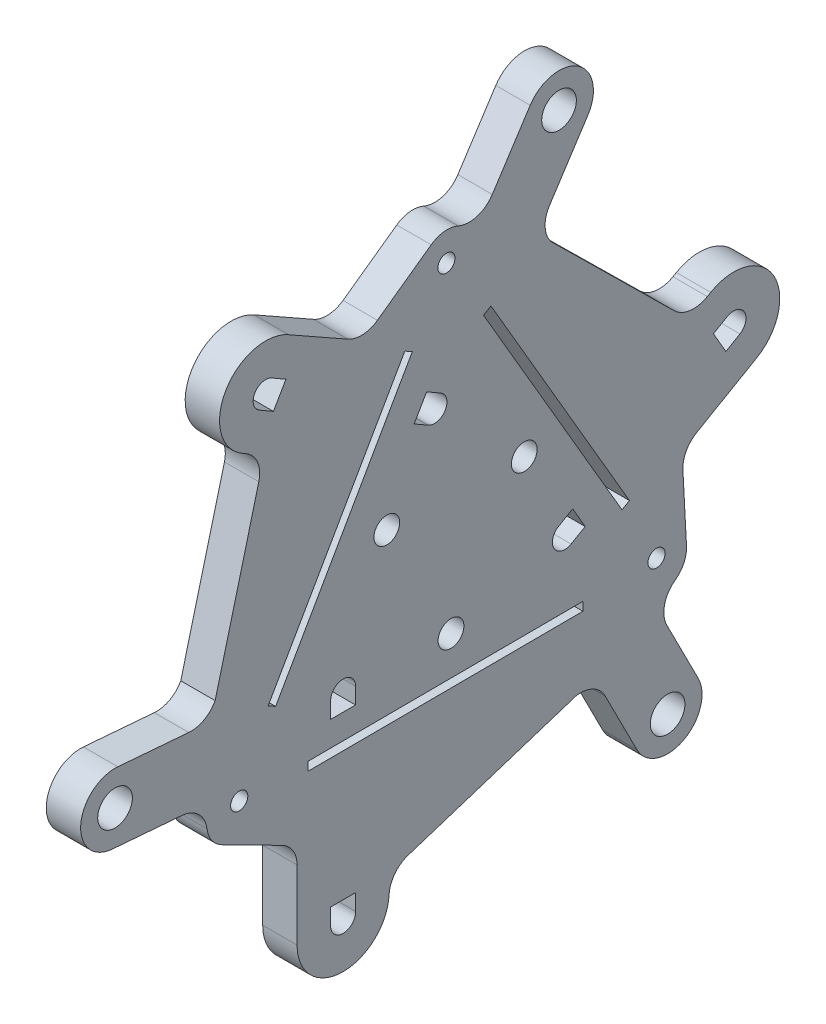
from build123d import *

# Parameters (mm, degrees)
BOSS_EXTRUDE1_DEPTH = 3.175
SKETCH7_R           = 0.79375
CUT_EXTRUDE6_DEPTH  = 59.953525128
SKETCH8_W           = 24
SKETCH8_H           = 4.7625
BOSS_EXTRUDE2_DEPTH = 3.175
BOSS_EXTRUDE3_DEPTH = 3.175
CUT_EXTRUDE8_DEPTH  = 3.175
CUT_EXTRUDE7_DEPTH  = 3.175
FILLET1_R           = 2.54
FILLET2_R           = 2.54
SKETCH13_R          = 1.190625
CUT_EXTRUDE9_DEPTH  = 3.175
CUT_EXTRUDE10_DEPTH = 3.175
SKETCH17_R          = 1.6
BOSS_EXTRUDE5_DEPTH = 3.175
FILLET4_R           = 2.54


with BuildPart() as part:
    # Sketch1 → Boss-Extrude1 (new body)
    with BuildSketch(Plane(origin=(0, 0, 0), x_dir=(0, 0, -1), z_dir=(1, 0, 0))):
        Polygon((43.890597967, 11.483842091), (31.890597967, 32.268451781), (22.25, 38.538130468), (44.5, 0), align=None)
        Polygon((22.25, 38.538130468), (44.5, 0), (0, 0), align=None)
        Polygon((0.899789316, 11.058480811), (12.899789316, 31.843090502), (22.25, 38.538130468), (0, 0), align=None)
        Polygon((10.25, -5.214163404), (34.25, -5.214163404), (44.5, 0), (0, 0), align=None)
    extrude(amount=BOSS_EXTRUDE1_DEPTH)

    # Sketch7 → Cut-Extrude6 (cut, through all)
    with BuildSketch(Plane.ZY):
        with Locations((-22.25, 35.363130468)):
            Circle(SKETCH7_R)
        with Locations((-3.119892109, 1.92699728)):
            Circle(SKETCH7_R)
        with Locations((-41.6414868, 2.077904463)):
            Circle(SKETCH7_R)
    extrude(amount=-CUT_EXTRUDE6_DEPTH, mode=Mode.SUBTRACT)

    # Sketch8 → Boss-Extrude2 (add)
    with BuildSketch(Plane.ZY):
        Polygon((-43.890597967, 11.483842091), (-31.890597967, 32.268451781), (-36.015043953, 34.649701781), (-48.015043953, 13.865092091), align=None)
        with Locations((-22.25, -7.595413404)):
            Rectangle(SKETCH8_W, SKETCH8_H)
        Polygon((-12.899789316, 31.843090502), (-0.899789316, 11.058480811), (3.22465667, 13.439730811), (-8.77534333, 34.224340502), align=None)
    extrude(amount=-BOSS_EXTRUDE2_DEPTH)

    # Sketch9 → Boss-Extrude3 (add)
    # profile 1 of 3: a face of its own
    with BuildSketch(Plane(origin=(3.175, 0, 0), x_dir=(0, 0, -1), z_dir=(1, 0, 0))):
        with BuildLine():
            Line((3.432653779, 29.558030749), (5.419099548, 28.411155749))
            Line((5.419099548, 28.411155749), (8.77534333, 34.224340502))
            Line((8.77534333, 34.224340502), (12.899789316, 31.843090502))
            Line((12.899789316, 31.843090502), (14.562601584, 33.033715502))
            Line((14.562601584, 33.033715502), (7.682653779, 36.919246681))
            ThreePointArc((7.682653779, 36.919246681), (1.877045812, 35.363638715), (3.432653779, 29.558030749))
        make_face()
        with BuildLine():
            Line((4.98264756, 32.24269873), (6.281769095, 31.492650563))
            Line((6.281769095, 31.492650563), (7.43173356, 33.484529507))
            Line((7.43173356, 33.484529507), (6.13264756, 34.234557159))
            ThreePointArc((6.13264756, 34.234557159), (4.561718346, 33.813627945), (4.98264756, 32.24269873))
        make_face(mode=Mode.SUBTRACT)
    # profile 2 of 3: a face of its own
    with BuildSketch(Plane(origin=(3.175, 0, 0), x_dir=(0, 0, -1), z_dir=(1, 0, 0))):
        with BuildLine():
            Line((8.462487563, -12.270413404), (8.462487563, -4.304857849))
            Line((8.462487563, -4.304857849), (10.25, -5.214163404))
            Line((10.25, -5.214163404), (10.25, -9.976663404))
            Line((10.25, -9.976663404), (20.606380555, -9.976663404))
            Line((20.606380555, -9.976663404), (20.606380555, -10.770413404))
            Line((20.606380555, -10.770413404), (16.962487563, -10.770413404))
            Line((16.962487563, -10.770413404), (16.962487563, -12.270413404))
            ThreePointArc((16.962487563, -12.270413404), (12.712487563, -16.520413404), (8.462487563, -12.270413404))
        make_face()
        with BuildLine():
            Line((11.5625, -12.270413404), (11.5625, -10.7703581))
            Line((11.5625, -10.7703581), (13.8625, -10.770317068))
            Line((13.8625, -10.770317068), (13.8625, -12.270413404))
            ThreePointArc((13.8625, -12.270413404), (12.7125, -13.457465158), (11.5625, -12.270413404))
        make_face(mode=Mode.SUBTRACT)
    # profile 3 of 3: a face of its own
    with BuildSketch(Plane(origin=(3.175, 0, 0), x_dir=(0, 0, -1), z_dir=(1, 0, 0))):
        with BuildLine():
            Line((46.645245941, 20.825151843), (44.658800171, 19.678276843))
            Line((44.658800171, 19.678276843), (48.015043953, 13.865092091))
            Line((48.015043953, 13.865092091), (43.890597967, 11.483842091))
            Line((43.890597967, 11.483842091), (43.996871736, 9.481172067))
            Line((43.996871736, 9.481172067), (50.895245941, 13.463935911))
            ThreePointArc((50.895245941, 13.463935911), (52.450853907, 19.269543877), (46.645245941, 20.825151843))
        make_face()
        with BuildLine():
            Line((48.195239723, 18.140483862), (46.896118188, 17.390435694))
            Line((46.896118188, 17.390435694), (48.046153723, 15.398212801))
            Line((48.046153723, 15.398212801), (49.345239723, 16.148625433))
            ThreePointArc((49.345239723, 16.148625433), (49.750491106, 17.710503048), (48.195239723, 18.140483862))
        make_face(mode=Mode.SUBTRACT)
    extrude(amount=-BOSS_EXTRUDE3_DEPTH)

    # Sketch12 → Cut-Extrude8 (cut)
    with BuildSketch(Plane(origin=(3.175, 0, 0), x_dir=(0, 0, -1), z_dir=(1, 0, 0))):
        with BuildLine():
            Line((33.756782454, 7.148625433), (35.055868454, 7.898653085))
            Line((35.055868454, 7.898653085), (33.905903989, 9.89053203))
            Line((33.905903989, 9.89053203), (32.606782454, 9.140483862))
            ThreePointArc((32.606782454, 9.140483862), (32.18585324, 7.569554647), (33.756782454, 7.148625433))
        make_face()
        with BuildLine():
            Line((21.721104828, 25.234557159), (20.422018828, 25.984584811))
            Line((20.422018828, 25.984584811), (19.271959255, 23.992760775))
            Line((19.271959255, 23.992760775), (20.571104828, 23.24269873))
            ThreePointArc((20.571104828, 23.24269873), (22.142034043, 23.663627945), (21.721104828, 25.234557159))
        make_face()
        with BuildLine():
            Line((13.8625, 5.729586596), (13.8625, 4.229490261))
            Line((13.8625, 4.229490261), (11.5625, 4.229531293))
            Line((11.5625, 4.229531293), (11.5625, 5.729586596))
            ThreePointArc((11.5625, 5.729586596), (12.7125, 6.879586596), (13.8625, 5.729586596))
        make_face()
    extrude(amount=-CUT_EXTRUDE8_DEPTH, mode=Mode.SUBTRACT)

    # Sketch10 → Cut-Extrude7 (cut)
    with BuildSketch(Plane(origin=(3.175, 0, 0), x_dir=(0, 0, -1), z_dir=(1, 0, 0))):
        Polygon((31.890597967, 32.268451781), (44.658800171, 19.678276843), (36.015043953, 34.649701781), align=None)
        Polygon((5.419099548, 28.411155749), (0.899789316, 11.058480811), (-3.22465667, 13.439730811), align=None)
        Polygon((16.962487563, -10.770413404), (34.25, -5.214163404), (34.25, -11.414104667), align=None)
    extrude(amount=-CUT_EXTRUDE7_DEPTH, mode=Mode.SUBTRACT)

    # Fillet1
    fillet1_edges = [part.edges().sort_by_distance(p)[0] for p in [
        (1.5875, -10.770413404, -16.962487563),
    ]]
    fillet(fillet1_edges, radius=FILLET1_R)

    # Fillet2
    fillet2_edges = [part.edges().sort_by_distance(p)[0] for p in [
        (1.5875, 19.678276843, -44.658800171),
        (1.5875, 9.481172067, -43.996871736),
        (1.5875, -4.304857849, -8.462487563),
        (1.5875, 0, -44.5),
        (1.5875, 0, 0),
        (1.5875, 38.538130468, -22.25),
        (1.5875, 33.033715502, -14.562601584),
        (1.5875, 28.411155749, -5.419099548),
    ]]
    fillet(fillet2_edges, radius=FILLET2_R)

    # Sketch13 → Cut-Extrude9 (cut)
    with BuildSketch(Plane.ZY):
        with BuildLine():
            ThreePointArc((-15.555361616, 16.777538207), (-16.768661404, 17.967947273), (-17.935747959, 16.732196856))
            Line((-17.935747959, 16.732196856), (-16.745986616, 16.777538207))
            Line((-16.745986616, 16.777538207), (-17.301600526, 15.724503984))
            ThreePointArc((-17.301600526, 15.724503984), (-16.131145141, 15.757951109), (-15.555361616, 16.777538207))
        make_face()
        with BuildLine():
            Line((-16.745986616, 16.777538207), (-17.935747959, 16.732196856))
            ThreePointArc((-17.935747959, 16.732196856), (-17.753679488, 16.143390774), (-17.301600526, 15.724503984))
            Line((-17.301600526, 15.724503984), (-16.745986616, 16.777538207))
        make_face()
        with Locations((-22.672534986, 5.545173165)):
            Circle(SKETCH13_R)
        with Locations((-29.436774271, 16.293897131)):
            Circle(SKETCH13_R)
    extrude(amount=-CUT_EXTRUDE9_DEPTH, mode=Mode.SUBTRACT)

    # Sketch14 → Cut-Extrude10 (cut)
    with BuildSketch(Plane.ZY):
        Polygon((-6.482836936, 7.804845527), (-19.096567387, 29.85147348), (-18.407610264, 30.245652557), (-5.793879812, 8.199024604), align=None)
        Polygon((-34.848617406, 2.021173684), (-9.448812305, 1.921670715), (-9.451921773, 1.127926805), (-34.851726873, 1.227429774), align=None)
        Polygon((-25.674533914, 29.478496091), (-38.460608564, 7.531371107), (-39.146456219, 7.930935939), (-26.36038157, 29.878060923), align=None)
    extrude(amount=-CUT_EXTRUDE10_DEPTH, mode=Mode.SUBTRACT)

    # Sketch17 → Boss-Extrude5 (add)
    # profile 1 of 3: a face of its own
    with BuildSketch(Plane.ZY):
        with BuildLine():
            Line((-35.808950658, -4.421126968), (-39.839725672, -12.34482262))
            ThreePointArc((-39.839725672, -12.34482262), (-44.109179481, -13.735151419), (-45.499508281, -9.46569761))
            Line((-45.499508281, -9.46569761), (-41.468733267, -1.542001958))
            Line((-41.468733267, -1.542001958), (-35.808950658, -4.421126968))
        make_face()
        with Locations((-42.669616976, -10.905260115)):
            Circle(SKETCH17_R, mode=Mode.SUBTRACT)
    # profile 2 of 3: a face of its own
    with BuildSketch(Plane.ZY):
        with BuildLine():
            Line((-0.261472593, 3.213518539), (8.599244609, 3.934483634))
            ThreePointArc((8.599244609, 3.934483634), (11.506298933, 7.356513026), (8.084269542, 10.26356735))
            Line((8.084269542, 10.26356735), (-0.77644766, 9.542602255))
            Line((-0.77644766, 9.542602255), (-0.261472593, 3.213518539))
        make_face()
        with Locations((8.341757075, 7.099025492)):
            Circle(SKETCH17_R, mode=Mode.SUBTRACT)
    # profile 3 of 3: a face of its own
    with BuildSketch(Plane.ZY):
        with BuildLine():
            Line((-25.13548002, 36.661583739), (-29.98221424, 44.114185124))
            ThreePointArc((-29.98221424, 44.114185124), (-34.374834099, 45.044851969), (-35.305500944, 40.65223211))
            Line((-35.305500944, 40.65223211), (-30.458766724, 33.199630725))
            Line((-30.458766724, 33.199630725), (-25.13548002, 36.661583739))
        make_face()
        with Locations((-32.643857592, 42.383208617)):
            Circle(SKETCH17_R, mode=Mode.SUBTRACT)
    extrude(amount=-BOSS_EXTRUDE5_DEPTH)

    # Fillet4
    # the kernel refuses this fillet: 2.54 mm, written as the material it adds along each edge
    with BuildSketch(Plane(origin=(0, 36.661583739, -25.13548002), x_dir=(0, 0.5315830218036889, 0.8470061929703104), z_dir=(1, 0, 0))) as fillet4_piece_1:
        with BuildLine():
            CenterArc((2.499765737, -2.512091747), FILLET4_R, 98.501304121, 80.573560632)
            Line((-0.039903163, -2.471081023), (-0.293870053, -2.46697995))
            Line((-0.293870053, -2.46697995), (-0.25396689, 0.004101072))
            Line((-0.25396689, 0.004101072), (0.004101072, 0.25396689))
            ThreePointArc((0.004101072, 0.25396689), (1.711869919, 0.226389737), (2.086723346, 0.251209175))
            Line((2.086723346, 0.251209175), (2.124272654, 0))
        make_face()
    extrude(amount=3.175)
    with BuildSketch(Plane(origin=(0, 33.199630725, -30.458766724), x_dir=(0, -0.5451894510403108, -0.838312866699757), z_dir=(1, 0, 0))) as fillet4_piece_2:
        with BuildLine():
            CenterArc((2.54, 2.399867047), FILLET4_R, 180, 70.879109992)
            Line((0, 2.399867047), (-0.0508, 2.399867047))
            Line((-0.0508, 2.399867047), (-0.0508, 0))
            Line((-0.0508, 0), (0, -0.0508))
            ThreePointArc((0, -0.0508), (0.853995746, -0.0508), (1.691351321, -0.047997341))
            Line((1.691351321, -0.047997341), (1.707991491, 0))
        make_face()
    extrude(amount=3.175)
    with BuildSketch(Plane(origin=(0, -1.542001958, -41.468733267), x_dir=(0, 0.466230647669412, -0.8846632032439015), z_dir=(1, 0, 0))) as fillet4_piece_3:
        with BuildLine():
            CenterArc((2.503946527, -2.514474671), FILLET4_R, 98.12963068, 81.042861753)
            Line((-0.035788565, -2.477791408), (-0.289762074, -2.474123082))
            Line((-0.289762074, -2.474123082), (-0.253973509, 0.003668326))
            Line((-0.253973509, 0.003668326), (0.003668326, 0.253973509))
            ThreePointArc((0.003668326, 0.253973509), (1.752552501, 0.228713088), (2.108838028, 0.251447467))
            Line((2.108838028, 0.251447467), (2.144756982, 0))
        make_face()
    extrude(amount=3.175)
    with BuildSketch(Plane(origin=(0, -4.421126968, -35.808950658), x_dir=(0, -0.4534055133611399, 0.8913043478261066), z_dir=(1, 0, 0))) as fillet4_piece_4:
        with BuildLine():
            CenterArc((2.54, 2.413715879), FILLET4_R, 180, 71.856915027)
            Line((0, 2.413715879), (-0.0508, 2.413715879))
            Line((-0.0508, 2.413715879), (-0.0508, 0))
            Line((-0.0508, 0), (0, -0.0508))
            ThreePointArc((0, -0.0508), (0.874533296, -0.0508), (1.733247924, -0.048274318))
            Line((1.733247924, -0.048274318), (1.749066592, 0))
        make_face()
    extrude(amount=3.175)
    with BuildSketch(Plane(origin=(0, 9.542602255, -0.77644766), x_dir=(0, 0.9967060969511591, -0.08109843586892752), z_dir=(1, 0, 0))) as fillet4_piece_5:
        with BuildLine():
            CenterArc((2.54, 2.326587881), FILLET4_R, 180, 66.345211462)
            Line((0, 2.326587881), (-0.0508, 2.326587881))
            Line((-0.0508, 2.326587881), (-0.0508, 0))
            Line((-0.0508, 0), (0, -0.0508))
            ThreePointArc((0, -0.0508), (0.760444107, -0.0508), (1.500505979, -0.046531758))
            Line((1.500505979, -0.046531758), (1.520888214, 0))
        make_face()
    extrude(amount=3.175)
    with BuildSketch(Plane(origin=(0, 3.213518539, -0.261472593), x_dir=(0, -0.9984457063976324, 0.05573303666706552), z_dir=(1, 0, 0))) as fillet4_piece_6:
        with BuildLine():
            CenterArc((2.477230301, -2.500513603), FILLET4_R, 100.115998519, 78.42721807)
            Line((-0.061948733, -2.435939367), (-0.315866636, -2.429481943))
            Line((-0.315866636, -2.429481943), (-0.253917903, 0.006457424))
            Line((-0.253917903, 0.006457424), (0.006457424, 0.253917903))
            ThreePointArc((0.006457424, 0.253917903), (1.526854064, 0.215252472), (1.986487618, 0.25005136))
            Line((1.986487618, 0.25005136), (2.031100589, 0))
        make_face()
    extrude(amount=3.175)


solid = part.part
